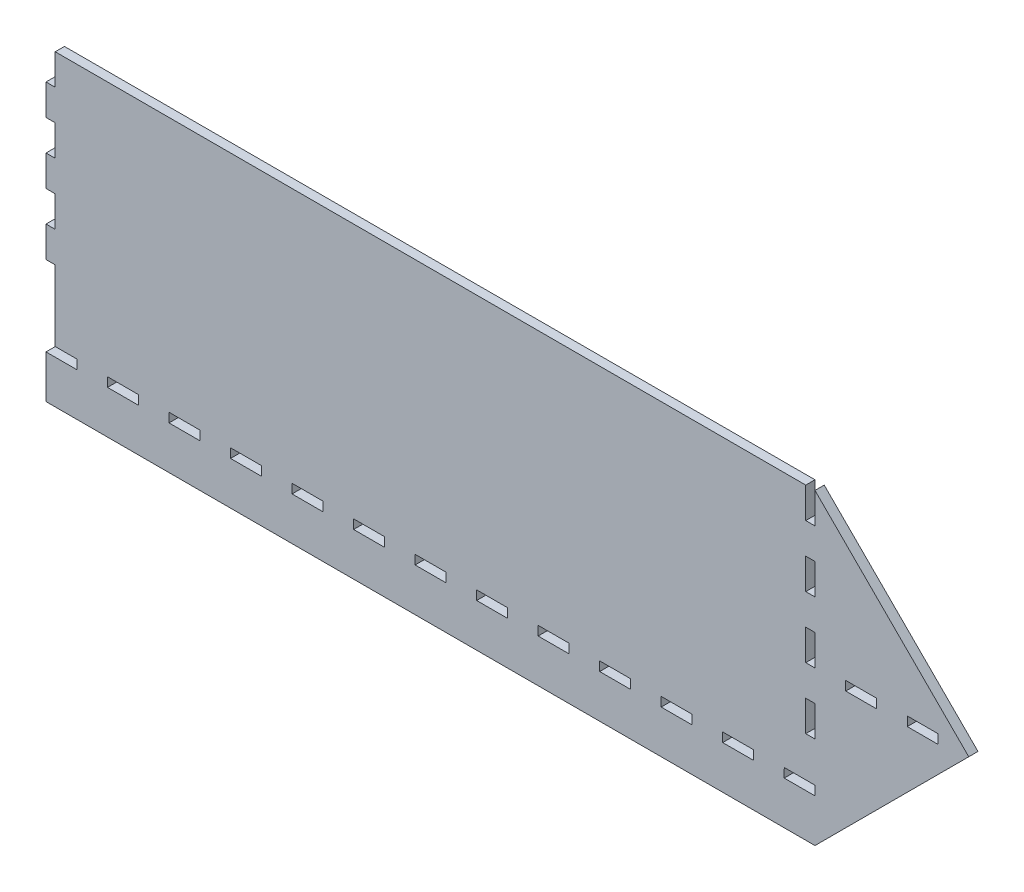
from build123d import *

# Parameters (mm, degrees)
SKETCH1_W           = 10
SKETCH1_H           = 3
SKETCH1_W_2         = 3
SKETCH1_H_2         = 10
BOSS_EXTRUDE1_DEPTH = 3


with BuildPart() as part:
    # Sketch1 → Boss-Extrude1 (new body)
    with BuildSketch(Plane.XY):
        Polygon((-112.631023813, -53.728350242), (-112.631023813, -67.728350242), (137.368976187, -67.728350242), (187.368976187, -17.728350242), (137.368976187, 32.271649758), (137.368976187, 22.271649758), (134.368976187, 22.271649758), (134.368976187, 32.271649758), (-62.631023813, 32.271649758), (-109.631023813, 32.271649758), (-109.631023813, 22.271649758), (-112.631023813, 22.271649758), (-112.631023813, 12.271649758), (-109.631023813, 12.271649758), (-109.631023813, 2.271649758), (-112.631023813, 2.271649758), (-112.631023813, -7.728350242), (-109.631023813, -7.728350242), (-109.631023813, -17.728350242), (-112.631023813, -17.728350242), (-112.631023813, -27.728350242), (-109.631023813, -27.728350242), (-109.631023813, -50.728350242), (-102.631023813, -50.728350242), (-102.631023813, -53.728350242), align=None)
        with Locations((-87.631023813, -52.228350242)):
            Rectangle(SKETCH1_W, SKETCH1_H, mode=Mode.SUBTRACT)
        with Locations((-67.631023813, -52.228350242)):
            Rectangle(SKETCH1_W, SKETCH1_H, mode=Mode.SUBTRACT)
        with Locations((-47.631023813, -52.228350242)):
            Rectangle(SKETCH1_W, SKETCH1_H, mode=Mode.SUBTRACT)
        with Locations((-27.631023813, -52.228350242)):
            Rectangle(SKETCH1_W, SKETCH1_H, mode=Mode.SUBTRACT)
        with Locations((-7.631023813, -52.228350242)):
            Rectangle(SKETCH1_W, SKETCH1_H, mode=Mode.SUBTRACT)
        with Locations((12.368976187, -52.228350242)):
            Rectangle(SKETCH1_W, SKETCH1_H, mode=Mode.SUBTRACT)
        Polygon((27.368976187, -50.728350242), (37.371405326, -50.728350242), (37.368976187, -53.728350242), (27.368976187, -53.728350242), align=None, mode=Mode.SUBTRACT)
        Polygon((47.371408604, -50.728350242), (57.373834464, -50.728350242), (57.368979465, -53.728350242), (47.368979465, -53.728350242), align=None, mode=Mode.SUBTRACT)
        Polygon((67.373847559, -50.728350242), (77.376263603, -50.728350242), (77.36899256, -53.728350242), (67.36899256, -53.728350242), align=None, mode=Mode.SUBTRACT)
        Polygon((87.376292974, -50.728350242), (97.378692742, -50.728350242), (97.369021931, -53.728350242), (87.369021931, -53.728350242), align=None, mode=Mode.SUBTRACT)
        Polygon((107.3787447, -50.728350242), (117.381121881, -50.728350242), (117.369073889, -53.728350242), (107.369073889, -53.728350242), align=None, mode=Mode.SUBTRACT)
        Polygon((127.381202522, -50.728350242), (137.381202522, -50.728350242), (137.36915453, -53.728350242), (127.36915453, -53.728350242), align=None, mode=Mode.SUBTRACT)
        with Locations((135.868976187, -32.728350242)):
            Rectangle(SKETCH1_W_2, SKETCH1_H_2, mode=Mode.SUBTRACT)
        with Locations((135.868976187, -12.728350242)):
            Rectangle(SKETCH1_W_2, SKETCH1_H_2, mode=Mode.SUBTRACT)
        with Locations((152.368976187, -17.728350242)):
            Rectangle(SKETCH1_W, SKETCH1_H, mode=Mode.SUBTRACT)
        with Locations((172.368976187, -17.728350242)):
            Rectangle(SKETCH1_W, SKETCH1_H, mode=Mode.SUBTRACT)
        with Locations((135.868976187, 7.271649758)):
            Rectangle(SKETCH1_W_2, SKETCH1_H_2, mode=Mode.SUBTRACT)
    extrude(amount=BOSS_EXTRUDE1_DEPTH)


solid = part.part
